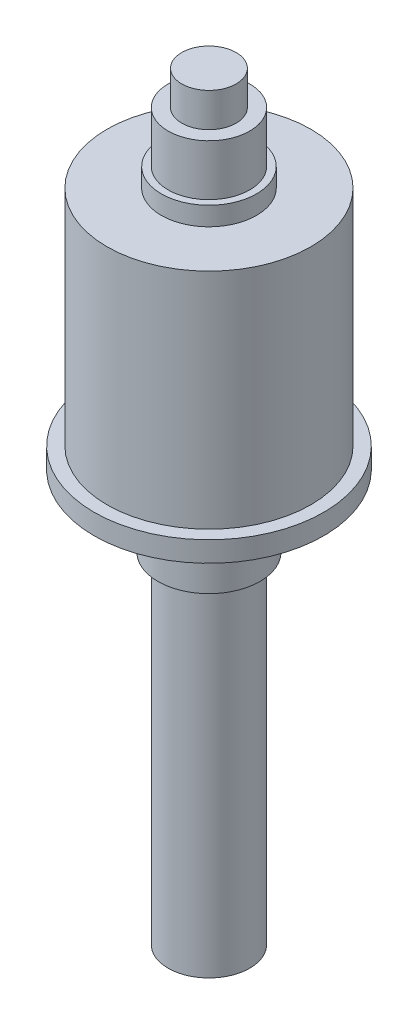
from build123d import *


with BuildPart() as part:
    # Sketch2 → Revolve1 (revolve)
    with BuildSketch(Plane.XY):
        Polygon((0, 0), (-4, 0), (-4, -5), (-6, -5), (-6, -12.5), (-7, -12.5), (-7, -15.25), (-14.9815, -15.25), (-14.9815, -48.11), (-16.8815, -48.11), (-16.8815, -51.11), (-9, -51.11), (-9, -53.61), (-7.5, -53.61), (-7.5, -61.61), (-6, -61.61), (-6, -111.61), (0, -111.61), align=None)
    revolve(axis=Axis((0, 40.033449689, 0), (0, -1, 0)))


solid = part.part
